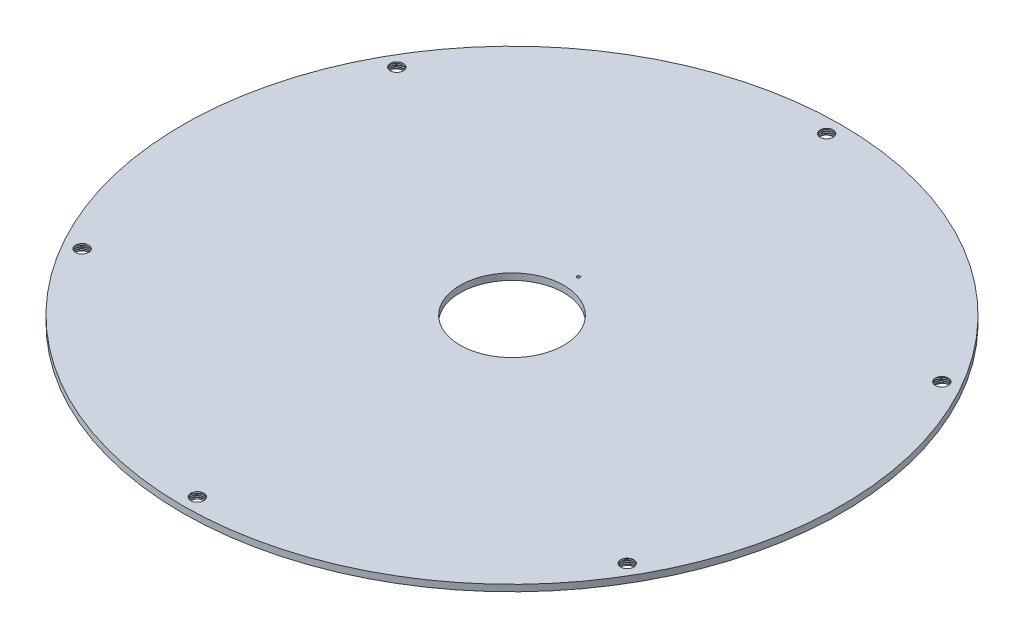
from build123d import *

# Parameters (mm, degrees)
SKETCH1_R               = 50.8
SKETCH1_R_2             = 8
SKETCH1_R_3             = 1
BOSS_EXTRUDE1_DEPTH     = 1
THREAD1_PITCH           = 0.25
CIRPATTERN1_COUNT       = 6
CUT_EXTRUDE1_DEPTH      = 72.849008487
CUT_EXTRUDE1_DEPTH_BACK = 72.849008487
SKETCH2_R               = 0.25


with BuildPart() as part:
    # Sketch1 → Boss-Extrude1 (new body)
    with BuildSketch(Plane(origin=(0, 0, 0), x_dir=(1, 0, 0), z_dir=(0, 1, 0))):
        with Locations(Location((0, 0, 0), (0, 0, 270))):
            Circle(SKETCH1_R)
        with Locations(Location((0, 0, 0), (0, 0, 270))):
            Circle(SKETCH1_R_2, mode=Mode.SUBTRACT)
        with Locations(Location((0, 48.5, 0), (0, 0, 270))):
            Circle(SKETCH1_R_3, mode=Mode.SUBTRACT)
        with Locations(Location((42.002232084, 24.25, 0), (0, 0, 270))):
            Circle(SKETCH1_R_3, mode=Mode.SUBTRACT)
        with Locations(Location((42.002232084, -24.25, 0), (0, 0, 270))):
            Circle(SKETCH1_R_3, mode=Mode.SUBTRACT)
        with Locations(Location((0, -48.5, 0), (0, 0, 270))):
            Circle(SKETCH1_R_3, mode=Mode.SUBTRACT)
        with Locations(Location((-42.002232084, -24.25, 0), (0, 0, 270))):
            Circle(SKETCH1_R_3, mode=Mode.SUBTRACT)
        with Locations(Location((-42.002232084, 24.25, 0), (0, 0, 270))):
            Circle(SKETCH1_R_3, mode=Mode.SUBTRACT)
    extrude(amount=BOSS_EXTRUDE1_DEPTH)

    # Thread1: arcs per turn and ends read off the stored shape
    # Thread1: the profile of Thread Profile1 profile screwed along a right-hand helix through 40 turns, 6 arcs to a turn; built about Z, then put on its axis
    thread1_z = Axis((0, 0, 0), (0, 0, 1))
    thread1_corners = [(0.9997, 0, -0.000173205), (1.135316469, 0, 0.078125), (1.135316469, 0, 0.109375), (0.9997, 0, 0.187673204)]
    with BuildLine(mode=Mode.PRIVATE) as thread1_profile:
        Line(thread1_corners[0], thread1_corners[1])
        Line(thread1_corners[1], thread1_corners[2])
        Line(thread1_corners[2], thread1_corners[3])
        Line(thread1_corners[3], thread1_corners[0])
    thread1_cap = Face(thread1_profile.wire())
    thread1_turn_angles = [0, 30, 60, 90, 120, 150, 180, 210, 240, 270, 300, 330, 360]
    thread1_turn_weights = [1, 0.8660254037844387, 1, 0.8660254037844387, 1, 0.8660254037844387, 1, 0.8660254037844387, 1, 0.8660254037844387, 1, 0.8660254037844387, 1]
    thread1_turn_rails = [Edge.make_bspline([Vector(p[0], p[1], 0).rotate(thread1_z, thread1_turn_angles[k]) / thread1_turn_weights[k] + Vector(0, 0, p[2] + THREAD1_PITCH * thread1_turn_angles[k] / 360) for k in range(13)], [0, 0, 0, 1, 1, 2, 2, 3, 3, 4, 4, 5, 5, 6, 6, 6], 2, thread1_turn_weights) for p in thread1_corners]
    thread1_turn_sides = [Face.make_surface_from_curves(thread1_turn_rails[p[0]], thread1_turn_rails[p[1]]) for p in [(0, 1), (1, 2), (2, 3), (3, 0)]]
    thread1 = Plane(origin=(0, 1, 48.5), x_dir=(-1, 0, 0), z_dir=(0, -1, 0)) * Solid(Shell([*[p.moved(Location((0, 0, THREAD1_PITCH * i))) for i in range(40) for p in thread1_turn_sides], thread1_cap, thread1_cap.rotate(thread1_z, 14400).moved(Location((0, 0, THREAD1_PITCH * 14400 / 360)))]))
    add(thread1, mode=Mode.SUBTRACT)

    # CirPattern1: Thread1 ×6 about axis
    cirpattern1_axis = Axis((0, 0, 0), (0, 1, 0))
    for i in range(1, CIRPATTERN1_COUNT):
        add(thread1.rotate(cirpattern1_axis, i * 360 / CIRPATTERN1_COUNT), mode=Mode.SUBTRACT)

    # Sketch2 → Cut-Extrude1 (cut, two sides: drawn at the far end of the back side and taken through both)
    with BuildSketch(Plane(origin=(0, 1, 0), x_dir=(1, 0, 0), z_dir=(0, 1, 0)).offset(-CUT_EXTRUDE1_DEPTH_BACK)):
        with Locations(Location((0, 10.25, 0), (0, 0, 270))):
            Circle(SKETCH2_R)
    extrude(amount=CUT_EXTRUDE1_DEPTH + CUT_EXTRUDE1_DEPTH_BACK, mode=Mode.SUBTRACT)


solid = part.part
